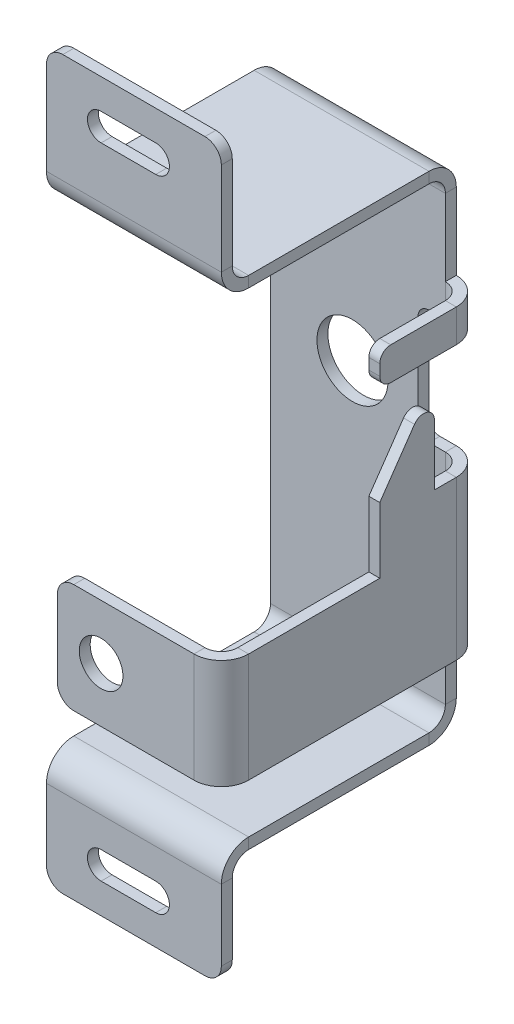
from build123d import *

# Parameters (mm, degrees)
SKETCH1_W                    = 91
SKETCH1_H                    = 32
BASE_FLANGE1_DEPTH           = 2
EDGE_FLANGE1_STRIP_W         = 14
EDGE_FLANGE1_STRIP_H         = 2
EDGE_FLANGE1_STRIP_CUT_DEPTH = 32
EDGE_FLANGE1_DEPTH           = 32
EDGE_FLANGE2_STRIP_W         = 14
EDGE_FLANGE2_STRIP_H         = 2
EDGE_FLANGE2_STRIP_CUT_DEPTH = 32
EDGE_FLANGE2_DEPTH           = 32
FILLET1_R                    = 3
EDGE_FLANGE3_DEPTH           = 29
EDGE_FLANGE3_START           = 2
EDGE_FLANGE3_FLAT_DEPTH      = 2
EDGE_FLANGE4_DEPTH           = 20
EDGE_FLANGE4_START           = 2
EDGE_FLANGE4_PROFILE_R       = 4
EDGE_FLANGE4_FLAT_DEPTH      = 2
SKETCH18_R                   = 6.5
CUT_EXTRUDE1_DEPTH           = 10
EDGE_FLANGE5_DEPTH           = 6
EDGE_FLANGE5_START           = 2
EDGE_FLANGE5_FLAT_DEPTH      = 2
EDGE_FLANGE6_STRIP_W         = 14
EDGE_FLANGE6_STRIP_H         = 2
EDGE_FLANGE6_STRIP_CUT_DEPTH = 32
EDGE_FLANGE6_DEPTH           = 32
EDGE_FLANGE7_STRIP_W         = 14
EDGE_FLANGE7_STRIP_H         = 2
EDGE_FLANGE7_STRIP_CUT_DEPTH = 32
EDGE_FLANGE7_DEPTH           = 32
EDGE_FLANGE7_FLAT_DEPTH      = 2
CUT_EXTRUDE2_DEPTH           = 10


# Sheet-metal steps are written as plain solids
with BuildPart() as part:
    # Sketch1 → Base-Flange1 (new body)
    with BuildSketch(Plane(origin=(0, 0, 0), x_dir=(0, 1, 0), z_dir=(0, 0, 1))):
        with Locations((-3.5, -1)):
            Rectangle(SKETCH1_W, SKETCH1_H)
    extrude(amount=BASE_FLANGE1_DEPTH)

    # Edge-Flange1 strip (across the edge) → Edge-Flange1 strip cut (cut)
    with BuildSketch(Plane(origin=(-15, -49, 2), x_dir=(0, 1, 0), z_dir=(1, 0, 0))):
        with Locations((-2, -1)):
            Rectangle(EDGE_FLANGE1_STRIP_W, EDGE_FLANGE1_STRIP_H)
    extrude(amount=EDGE_FLANGE1_STRIP_CUT_DEPTH, mode=Mode.SUBTRACT)

    # Edge-Flange1 section (across the edge) → Edge-Flange1 (add)
    with BuildSketch(Plane(origin=(-15, -49, 2), x_dir=(0, 1, 0), z_dir=(1, 0, 0))):
        with BuildLine():
            Line((0, 3), (0, 41))
            Line((0, 41), (2, 41))
            Line((2, 41), (2, 3))
            ThreePointArc((2, 3), (2.878679656, 0.878679656), (5, 0))
            Line((5, 0), (5, -2))
            ThreePointArc((5, -2), (1.464466094, -0.535533906), (0, 3))
        make_face()
    extrude(amount=EDGE_FLANGE1_DEPTH)

    # Edge-Flange2 strip (across the edge) → Edge-Flange2 strip cut (cut)
    with BuildSketch(Plane(origin=(17, -49, 43), x_dir=(0, 0, -1), z_dir=(-1, 0, 0))):
        with Locations((-2, -1)):
            Rectangle(EDGE_FLANGE2_STRIP_W, EDGE_FLANGE2_STRIP_H)
    extrude(amount=EDGE_FLANGE2_STRIP_CUT_DEPTH, mode=Mode.SUBTRACT)

    # Edge-Flange2 section (across the edge) → Edge-Flange2 (add)
    with BuildSketch(Plane(origin=(17, -49, 43), x_dir=(0, 0, -1), z_dir=(-1, 0, 0))):
        with BuildLine():
            Line((0, 3), (0, 19))
            Line((0, 19), (2, 19))
            Line((2, 19), (2, 3))
            ThreePointArc((2, 3), (2.878679656, 0.878679656), (5, 0))
            Line((5, 0), (5, -2))
            ThreePointArc((5, -2), (1.464466094, -0.535533906), (0, 3))
        make_face()
    extrude(amount=EDGE_FLANGE2_DEPTH)

    # Fillet1
    fillet1_edges = [part.edges().sort_by_distance(p)[0] for p in [
        (17, -68, 42),
        (-15, -68, 42),
    ]]
    fillet(fillet1_edges, radius=FILLET1_R)

    # Edge-Flange3 bend section (across the edge) → Edge-Flange3 (add)
    with BuildSketch(Plane(origin=(20, -33, 2), x_dir=(-1, 0, 0), z_dir=(0, 1, 0))):
        with BuildLine():
            Line((-2, 3), (0, 3))
            ThreePointArc((0, 3), (0.878679656, 0.878679656), (3, 0))
            Line((3, 0), (3, -2))
            ThreePointArc((3, -2), (-0.535533906, -0.535533906), (-2, 3))
        make_face()
    extrude(amount=EDGE_FLANGE3_DEPTH)

    # Edge-Flange3 profile (on flange) → Edge-Flange3 flat (add)
    with BuildSketch(Plane(origin=(20, 0, 2), x_dir=(0, 1, 0), z_dir=(1, 0, 0)).offset(EDGE_FLANGE3_START)):
        with BuildLine():
            Line((-33, 41), (-33, 3))
            Line((-33, 3), (-4, 3))
            Line((-4, 3), (-4, 7))
            Line((-4, 7), (7.090242207, 7))
            ThreePointArc((7.090242207, 7), (9, 8.406009114), (8.22462093, 10.647174828))
            Line((8.22462093, 10.647174828), (-1, 17))
            Line((-1, 17), (-13, 17))
            Line((-13, 17), (-13, 41))
            Line((-13, 41), (-33, 41))
        make_face()
    extrude(amount=-EDGE_FLANGE3_FLAT_DEPTH)

    # Edge-Flange4 bend section (across the edge) → Edge-Flange4 (add)
    with BuildSketch(Plane(origin=(20, -33, 46), x_dir=(0, 0, -1), z_dir=(0, 1, 0))):
        with BuildLine():
            Line((-2, 3), (0, 3))
            ThreePointArc((0, 3), (0.878679656, 0.878679656), (3, 0))
            Line((3, 0), (3, -2))
            ThreePointArc((3, -2), (-0.535533906, -0.535533906), (-2, 3))
        make_face()
    extrude(amount=EDGE_FLANGE4_DEPTH)

    # Edge-Flange4 profile (on flange) → Edge-Flange4 flat (add)
    with BuildSketch(Plane(origin=(20, 0, 46), x_dir=(0, 1, 0), z_dir=(0, 0, 1)).offset(EDGE_FLANGE4_START)):
        with BuildLine():
            ThreePointArc((-13, 25), (-13.878679656, 27.121320344), (-16, 28))
            Line((-16, 28), (-30, 28))
            ThreePointArc((-30, 28), (-32.121320344, 27.121320344), (-33, 25))
            Line((-33, 25), (-33, 3))
            Line((-33, 3), (-13, 3))
            Line((-13, 3), (-13, 25))
        make_face()
        with Locations((-23, 20)):
            Circle(EDGE_FLANGE4_PROFILE_R, mode=Mode.SUBTRACT)
    extrude(amount=-EDGE_FLANGE4_FLAT_DEPTH)

    # Sketch18 → Cut-Extrude1 (cut)
    with BuildSketch(Plane.XY.offset(2)):
        with Locations((0, 2)):
            Circle(SKETCH18_R)
        with BuildLine():
            Line((17, -4), (14, -4))
            ThreePointArc((14, -4), (12.585786438, -3.414213562), (12, -2))
            Line((12, -2), (12, 15))
            ThreePointArc((12, 15), (12.585786438, 16.414213562), (14, 17))
            Line((14, 17), (17, 17))
            Line((17, 17), (17, -4))
        make_face()
    extrude(amount=-CUT_EXTRUDE1_DEPTH, mode=Mode.SUBTRACT)

    # Edge-Flange5 bend section (across the edge) → Edge-Flange5 (add)
    with BuildSketch(Plane(origin=(20, 17, 2), x_dir=(-1, 0, 0), z_dir=(0, 1, 0))):
        with BuildLine():
            Line((-2, 3), (0, 3))
            ThreePointArc((0, 3), (0.878679656, 0.878679656), (3, 0))
            Line((3, 0), (3, -2))
            ThreePointArc((3, -2), (-0.535533906, -0.535533906), (-2, 3))
        make_face()
    extrude(amount=EDGE_FLANGE5_DEPTH)

    # Edge-Flange5 profile (on flange) → Edge-Flange5 flat (add)
    with BuildSketch(Plane(origin=(20, 0, 2), x_dir=(0, 1, 0), z_dir=(1, 0, 0)).offset(EDGE_FLANGE5_START)):
        with BuildLine():
            Line((17, 3), (23, 3))
            Line((23, 3), (23, 15))
            ThreePointArc((23, 15), (22.414213562, 16.414213562), (21, 17))
            Line((21, 17), (19, 17))
            ThreePointArc((19, 17), (17.585786438, 16.414213562), (17, 15))
            Line((17, 15), (17, 3))
        make_face()
    extrude(amount=-EDGE_FLANGE5_FLAT_DEPTH)

    # Edge-Flange6 strip (across the edge) → Edge-Flange6 strip cut (cut)
    with BuildSketch(Plane(origin=(17, 42, 2), x_dir=(0, -1, 0), z_dir=(-1, 0, 0))):
        with Locations((-2, -1)):
            Rectangle(EDGE_FLANGE6_STRIP_W, EDGE_FLANGE6_STRIP_H)
    extrude(amount=EDGE_FLANGE6_STRIP_CUT_DEPTH, mode=Mode.SUBTRACT)

    # Edge-Flange6 section (across the edge) → Edge-Flange6 (add)
    with BuildSketch(Plane(origin=(17, 42, 2), x_dir=(0, -1, 0), z_dir=(-1, 0, 0))):
        with BuildLine():
            Line((0, 3), (0, 41))
            Line((0, 41), (2, 41))
            Line((2, 41), (2, 3))
            ThreePointArc((2, 3), (2.878679656, 0.878679656), (5, 0))
            Line((5, 0), (5, -2))
            ThreePointArc((5, -2), (1.464466094, -0.535533906), (0, 3))
        make_face()
    extrude(amount=EDGE_FLANGE6_DEPTH)

    # Edge-Flange7 strip (across the edge) → Edge-Flange7 strip cut (cut)
    with BuildSketch(Plane(origin=(-15, 42, 43), x_dir=(0, 0, -1), z_dir=(1, 0, 0))):
        with Locations((-2, -1)):
            Rectangle(EDGE_FLANGE7_STRIP_W, EDGE_FLANGE7_STRIP_H)
    extrude(amount=EDGE_FLANGE7_STRIP_CUT_DEPTH, mode=Mode.SUBTRACT)

    # Edge-Flange7 bend section (across the edge) → Edge-Flange7 (add)
    with BuildSketch(Plane(origin=(-15, 42, 43), x_dir=(0, 0, -1), z_dir=(1, 0, 0))):
        with BuildLine():
            Line((0, 3), (2, 3))
            ThreePointArc((2, 3), (2.878679656, 0.878679656), (5, 0))
            Line((5, 0), (5, -2))
            ThreePointArc((5, -2), (1.464466094, -0.535533906), (0, 3))
        make_face()
    extrude(amount=EDGE_FLANGE7_DEPTH)

    # Edge-Flange7 profile (on flange) → Edge-Flange7 flat (add)
    with BuildSketch(Plane(origin=(0, 42, 43), x_dir=(1, 0, 0), z_dir=(0, 0, 1))):
        with BuildLine():
            ThreePointArc((-12, 23), (-14.121320344, 22.121320344), (-15, 20))
            Line((-15, 20), (-15, 3))
            Line((-15, 3), (17, 3))
            Line((17, 3), (17, 20))
            ThreePointArc((17, 20), (16.121320344, 22.121320344), (14, 23))
            Line((14, 23), (-12, 23))
        make_face()
        with BuildLine():
            Line((-5, 17.5), (5, 17.5))
            ThreePointArc((5, 17.5), (7.5, 15), (5, 12.5))
            Line((5, 12.5), (-5, 12.5))
            ThreePointArc((-5, 12.5), (-7.5, 15), (-5, 17.5))
        make_face(mode=Mode.SUBTRACT)
    extrude(amount=-EDGE_FLANGE7_FLAT_DEPTH)

    # Sketch28 → Cut-Extrude2 (cut)
    with BuildSketch(Plane.XY.offset(43)):
        with BuildLine():
            Line((-5, -57.5), (5, -57.5))
            ThreePointArc((5, -57.5), (7.5, -60), (5, -62.5))
            Line((5, -62.5), (-5, -62.5))
            ThreePointArc((-5, -62.5), (-7.5, -60), (-5, -57.5))
        make_face()
    extrude(amount=-CUT_EXTRUDE2_DEPTH, mode=Mode.SUBTRACT)


solid = part.part
